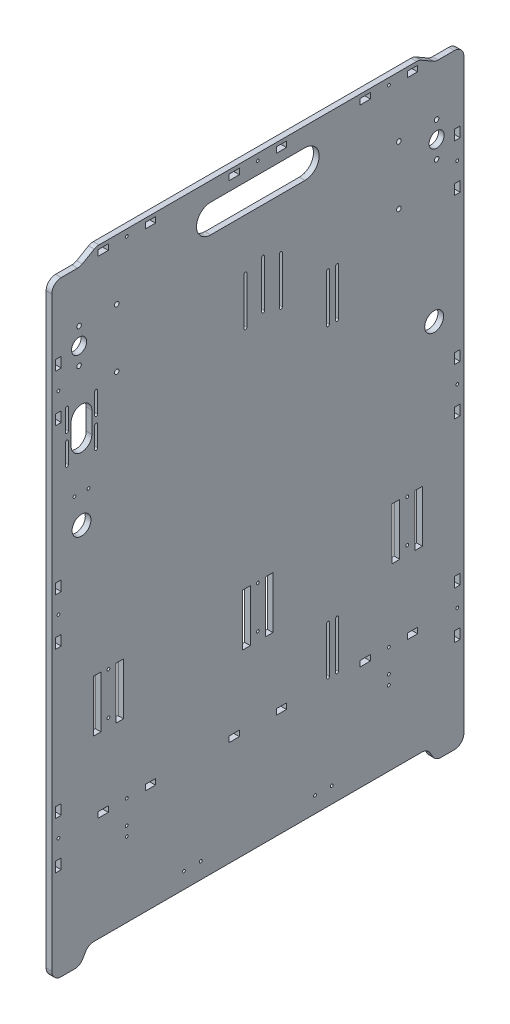
from build123d import *
from build123d.topology import SkipClean

# Parameters (mm, degrees)
SKETCH1_R             = 1.5
SKETCH1_W             = 10.8
SKETCH1_H             = 6
SKETCH1_H_2           = 7
SKETCH1_W_2           = 6
SKETCH1_H_3           = 10.8
BOSS_EXTRUDE1_DEPTH   = 6
SKETCH2_R             = 8
SKETCH2_R_2           = 2.425
CUT_EXTRUDE1_DEPTH    = 688.648458516
FILLET2_R             = 10
FILLET2_OF_MIRROR1_R  = 10
CUT_EXTRUDE2_DEPTH    = 688.648458516
SKETCH4_R             = 2.425
SKETCH4_R_2           = 1.5
SKETCH4_W             = 8
SKETCH4_H             = 55
CUT_EXTRUDE3_DEPTH    = 688.648458516
SKETCH5_R             = 1.5
CUT_EXTRUDE6_DEPTH    = 688.648458516
DELETEFACE2_START     = -169.366666667
DELETEFACE2_OUTLINE_W = 6
DELETEFACE2_OUTLINE_H = 7
DELETEFACE2_DEPTH     = 338.733333334
SKETCH7_R             = 1.5
CUT_EXTRUDE7_DEPTH    = 688.648458516
DELETEFACE3_OUTLINE_R = 1.5
DELETEFACE3_DEPTH     = 6
CUT_EXTRUDE8_DEPTH    = 688.648458516
SKETCH9_R             = 10
CUT_EXTRUDE9_DEPTH    = 688.648458516
SKETCH10_R            = 1.5
CUT_EXTRUDE10_DEPTH   = 688.648458516
CUT_EXTRUDE11_DEPTH   = 688.648458516


# Read off the part's stored shape, not the designer's step: DeleteFace2, DeleteFace3
with BuildPart() as part:
    # Sketch1 → Boss-Extrude1 (new body)
    with BuildSketch(Plane(origin=(0, 0, 0), x_dir=(0, 0, -1), z_dir=(1, 0, 0))):
        with BuildLine():
            Line((0, 652), (-171.129491924, 652))
            Line((-171.129491924, 652), (-188.45, 642))
            Line((-188.45, 642), (-218.45, 642))
            Line((-218.45, 642), (-218.45, 0))
            Line((-218.45, 0), (-188.45, 0))
            Line((-188.45, 0), (-179.789745962, 15))
            Line((-179.789745962, 15), (0, 15))
            Line((0, 15), (0, 127.5))
            ThreePointArc((0, 127.5), (-1.5, 129), (0, 130.5))
            Line((0, 130.5), (0, 643.5))
            ThreePointArc((0, 643.5), (-1.5, 645), (0, 646.5))
            Line((0, 646.5), (0, 652))
        make_face()
        with Locations((-211.45, 539.333333333)):
            Circle(SKETCH1_R, mode=Mode.SUBTRACT)
        with Locations((-211.45, 334)):
            Circle(SKETCH1_R, mode=Mode.SUBTRACT)
        with Locations((-211.45, 128.666666667)):
            Circle(SKETCH1_R, mode=Mode.SUBTRACT)
        with Locations((-138.966666667, 129)):
            Circle(SKETCH1_R, mode=Mode.SUBTRACT)
        with Locations((-138.966666667, 645)):
            Circle(SKETCH1_R, mode=Mode.SUBTRACT)
        with Locations((-113.966666667, 645)):
            Rectangle(SKETCH1_W, SKETCH1_H, mode=Mode.SUBTRACT)
        with Locations((-113.966666667, 129)):
            Rectangle(SKETCH1_W, SKETCH1_H, mode=Mode.SUBTRACT)
        with Locations((-113.966666667, 22.5)):
            Rectangle(SKETCH1_W, SKETCH1_H_2, mode=Mode.SUBTRACT)
        with Locations((-211.45, 564.333333333)):
            Rectangle(SKETCH1_W_2, SKETCH1_H_3, mode=Mode.SUBTRACT)
        with Locations((-211.45, 514.333333333)):
            Rectangle(SKETCH1_W_2, SKETCH1_H_3, mode=Mode.SUBTRACT)
        with Locations((-211.45, 359)):
            Rectangle(SKETCH1_W_2, SKETCH1_H_3, mode=Mode.SUBTRACT)
        with Locations((-211.45, 309)):
            Rectangle(SKETCH1_W_2, SKETCH1_H_3, mode=Mode.SUBTRACT)
        with Locations((-211.45, 153.666666667)):
            Rectangle(SKETCH1_W_2, SKETCH1_H_3, mode=Mode.SUBTRACT)
        with Locations((-211.45, 103.666666667)):
            Rectangle(SKETCH1_W_2, SKETCH1_H_3, mode=Mode.SUBTRACT)
        with Locations((-163.966666667, 129)):
            Rectangle(SKETCH1_W, SKETCH1_H, mode=Mode.SUBTRACT)
        with Locations((-25, 645)):
            Rectangle(SKETCH1_W, SKETCH1_H, mode=Mode.SUBTRACT)
        with Locations((-25, 129)):
            Rectangle(SKETCH1_W, SKETCH1_H, mode=Mode.SUBTRACT)
        with Locations((-163.966666667, 22.5)):
            Rectangle(SKETCH1_W, SKETCH1_H_2, mode=Mode.SUBTRACT)
        with Locations((-25, 22.5)):
            Rectangle(SKETCH1_W, SKETCH1_H_2, mode=Mode.SUBTRACT)
        with Locations((-163.966666667, 645)):
            Rectangle(SKETCH1_W, SKETCH1_H, mode=Mode.SUBTRACT)
    boss_extrude1 = extrude(amount=BOSS_EXTRUDE1_DEPTH)

    # Sketch2 → Cut-Extrude1 (cut, through all)
    with BuildSketch(Plane(origin=(6, 0, 0), x_dir=(0, 0, -1), z_dir=(1, 0, 0))):
        with Locations((-189.55, 569.8)):
            Circle(SKETCH2_R)
        with Locations((-189.55, 588.05)):
            Circle(SKETCH2_R_2)
        with Locations((-189.55, 551.55)):
            Circle(SKETCH2_R_2)
    cut_extrude1 = extrude(amount=-CUT_EXTRUDE1_DEPTH, mode=Mode.SUBTRACT)

    # Fillet2
    fillet2_edges = [part.edges().sort_by_distance(p)[0] for p in [
        (3, 15, 179.789745962),
        (3, 0, 188.45),
        (3, 0, 218.45),
        (3, 642, 218.45),
        (3, 642, 188.45),
        (3, 652, 171.129491924),
    ]]
    fillet(fillet2_edges, radius=FILLET2_R)

    # Mirror1: Boss-Extrude1, Cut-Extrude1 across plane
    with SkipClean():  # the faces are left unmerged after this step: merging them gives an invalid solid
        add(boss_extrude1.mirror(Plane(origin=(6, 130.5, 0), x_dir=(1, 0, 0), z_dir=(0, 0, 1))))
        add(cut_extrude1.mirror(Plane(origin=(6, 130.5, 0), x_dir=(1, 0, 0), z_dir=(0, 0, 1))), mode=Mode.SUBTRACT)

    # Fillet2 of Mirror1
    fillet2_of_mirror1_edges = [part.edges().sort_by_distance(p)[0] for p in [
        (3, 15, -179.789745962),
        (3, 0, -188.45),
        (3, 0, -218.45),
        (3, 642, -218.45),
        (3, 642, -188.45),
        (3, 652, -171.129491924),
    ]]
    fillet(fillet2_of_mirror1_edges, radius=FILLET2_OF_MIRROR1_R)

    # Sketch3 → Cut-Extrude2 (cut, through all)
    with BuildSketch(Plane(origin=(6, 0, 0), x_dir=(0, 0, -1), z_dir=(1, 0, 0))):
        with BuildLine():
            Line((-50, 632), (50, 632))
            ThreePointArc((50, 632), (65, 617), (50, 602))
            Line((50, 602), (-50, 602))
            ThreePointArc((-50, 602), (-65, 617), (-50, 632))
        make_face()
    extrude(amount=-CUT_EXTRUDE2_DEPTH, mode=Mode.SUBTRACT)

    # Sketch4 → Cut-Extrude3 (cut, through all)
    with BuildSketch(Plane(origin=(6, 0, 0), x_dir=(0, 0, -1), z_dir=(1, 0, 0))):
        with Locations((-149.55, 588.05)):
            Circle(SKETCH4_R)
        with Locations((-149.55, 526.05)):
            Circle(SKETCH4_R)
        with Locations((-158.45, 257.333333333)):
            Circle(SKETCH4_R_2)
        with Locations((-158.45, 212.833333333)):
            Circle(SKETCH4_R_2)
        with Locations((0, 257.333333333)):
            Circle(SKETCH4_R_2)
        with Locations((0, 212.833333333)):
            Circle(SKETCH4_R_2)
        with Locations((-170.45, 231.333333333)):
            Rectangle(SKETCH4_W, SKETCH4_H)
        with Locations((-146.45, 231.333333333)):
            Rectangle(SKETCH4_W, SKETCH4_H)
        with Locations((-12, 231.333333333)):
            Rectangle(SKETCH4_W, SKETCH4_H)
        with Locations((12, 231.333333333)):
            Rectangle(SKETCH4_W, SKETCH4_H)
    cut_extrude3 = extrude(amount=-CUT_EXTRUDE3_DEPTH, mode=Mode.SUBTRACT)

    # Mirror2: Cut-Extrude3 across plane
    add(cut_extrude3.mirror(Plane.XY), mode=Mode.SUBTRACT)

    # Sketch5 → Cut-Extrude6 (cut, through all)
    with BuildSketch(Plane(origin=(6, 0, 0), x_dir=(0, 0, -1), z_dir=(1, 0, 0))):
        with Locations((-78.383333333, 31.95)):
            Circle(SKETCH5_R)
        with Locations((-60.583333333, 31.95)):
            Circle(SKETCH5_R)
    cut_extrude6 = extrude(amount=-CUT_EXTRUDE6_DEPTH, mode=Mode.SUBTRACT)

    # Mirror3: Cut-Extrude6 across plane
    add(cut_extrude6.mirror(Plane.XY), mode=Mode.SUBTRACT)

    # DeleteFace2 outline → DeleteFace2 (add)
    with BuildSketch(Plane.XY.offset(DELETEFACE2_START)):
        with Locations((3, 22.5)):
            Rectangle(DELETEFACE2_OUTLINE_W, DELETEFACE2_OUTLINE_H)
    extrude(amount=DELETEFACE2_DEPTH)

    # Sketch7 → Cut-Extrude7 (cut, through all)
    with BuildSketch(Plane(origin=(6, 0, 0), x_dir=(0, 0, -1), z_dir=(1, 0, 0))):
        with Locations((-194.45, 433.843908623)):
            Circle(SKETCH7_R)
        with Locations((-179.45, 433.843908623)):
            Circle(SKETCH7_R)
        with BuildLine():
            Line((-200.95, 519.343908623), (-200.95, 497.343908623))
            ThreePointArc((-200.95, 497.343908623), (-202.45, 495.843908623), (-203.95, 497.343908623))
            Line((-203.95, 497.343908623), (-203.95, 519.343908623))
            ThreePointArc((-203.95, 519.343908623), (-202.45, 520.843908623), (-200.95, 519.343908623))
        make_face()
        with BuildLine():
            Line((-169.95, 519.343908623), (-169.95, 497.343908623))
            ThreePointArc((-169.95, 497.343908623), (-171.45, 495.843908623), (-172.95, 497.343908623))
            Line((-172.95, 497.343908623), (-172.95, 519.343908623))
            ThreePointArc((-172.95, 519.343908623), (-171.45, 520.843908623), (-169.95, 519.343908623))
        make_face()
        with BuildLine():
            Line((-169.95, 488.343908623), (-169.95, 466.343908623))
            ThreePointArc((-169.95, 466.343908623), (-171.45, 464.843908623), (-172.95, 466.343908623))
            Line((-172.95, 466.343908623), (-172.95, 488.343908623))
            ThreePointArc((-172.95, 488.343908623), (-171.45, 489.843908623), (-169.95, 488.343908623))
        make_face()
        with BuildLine():
            Line((-200.95, 488.343908623), (-200.95, 466.343908623))
            ThreePointArc((-200.95, 466.343908623), (-202.45, 464.843908623), (-203.95, 466.343908623))
            Line((-203.95, 466.343908623), (-203.95, 488.343908623))
            ThreePointArc((-203.95, 488.343908623), (-202.45, 489.843908623), (-200.95, 488.343908623))
        make_face()
        with BuildLine():
            Line((-197.95, 481.843908623), (-197.95, 503.843908623))
            ThreePointArc((-197.95, 503.843908623), (-186.95, 514.843908623), (-175.95, 503.843908623))
            Line((-175.95, 503.843908623), (-175.95, 481.843908623))
            ThreePointArc((-175.95, 481.843908623), (-186.95, 470.843908623), (-197.95, 481.843908623))
        make_face()
    extrude(amount=-CUT_EXTRUDE7_DEPTH, mode=Mode.SUBTRACT)

    # DeleteFace3 outline → DeleteFace3 (add)
    with BuildSketch(Plane.YZ):
        with Locations((129, 0)):
            Circle(DELETEFACE3_OUTLINE_R)
    extrude(amount=DELETEFACE3_DEPTH)

    # Sketch8 → Cut-Extrude8 (cut, through all)
    with BuildSketch(Plane(origin=(6, 0, 0), x_dir=(0, 0, -1), z_dir=(1, 0, 0))):
        with BuildLine():
            Line((72.925, 133.5), (72.925, 183.5))
            ThreePointArc((72.925, 183.5), (74.425, 185), (75.925, 183.5))
            Line((75.925, 183.5), (75.925, 133.5))
            ThreePointArc((75.925, 133.5), (74.425, 132), (72.925, 133.5))
        make_face()
        with BuildLine():
            Line((82.525, 133.5), (82.525, 183.5))
            ThreePointArc((82.525, 183.5), (84.025, 185), (85.525, 183.5))
            Line((85.525, 183.5), (85.525, 133.5))
            ThreePointArc((85.525, 133.5), (84.025, 132), (82.525, 133.5))
        make_face()
        with BuildLine():
            Line((72.925, 457), (72.925, 507))
            ThreePointArc((72.925, 507), (74.425, 508.5), (75.925, 507))
            Line((75.925, 507), (75.925, 457))
            ThreePointArc((75.925, 457), (74.425, 455.5), (72.925, 457))
        make_face()
        with BuildLine():
            Line((82.525, 457), (82.525, 507))
            ThreePointArc((82.525, 507), (84.025, 508.5), (85.525, 507))
            Line((85.525, 507), (85.525, 457))
            ThreePointArc((85.525, 457), (84.025, 455.5), (82.525, 457))
        make_face()
    extrude(amount=-CUT_EXTRUDE8_DEPTH, mode=Mode.SUBTRACT)

    # Sketch9 → Cut-Extrude9 (cut, through all)
    with BuildSketch(Plane(origin=(6, 0, 0), x_dir=(0, 0, -1), z_dir=(1, 0, 0))):
        with Locations((-186.95, 403.843908623)):
            Circle(SKETCH9_R)
    cut_extrude9 = extrude(amount=-CUT_EXTRUDE9_DEPTH, mode=Mode.SUBTRACT)

    # Mirror4: Cut-Extrude9 across plane
    add(cut_extrude9.mirror(Plane.XY), mode=Mode.SUBTRACT)

    # Sketch10 → Cut-Extrude10 (cut, through all)
    with BuildSketch(Plane(origin=(6, 0, 0), x_dir=(0, 0, -1), z_dir=(1, 0, 0))):
        with Locations((-138.966666667, 94)):
            Circle(SKETCH10_R)
        with Locations((-138.966666667, 104)):
            Circle(SKETCH10_R)
    cut_extrude10 = extrude(amount=-CUT_EXTRUDE10_DEPTH, mode=Mode.SUBTRACT)

    # Mirror5: Cut-Extrude10 across plane
    add(cut_extrude10.mirror(Plane.XY), mode=Mode.SUBTRACT)

    # Sketch11 → Cut-Extrude11 (cut, through all)
    with BuildSketch(Plane(origin=(6, 0, 0), x_dir=(0, 0, -1), z_dir=(1, 0, 0))):
        with BuildLine():
            Line((4.15, 503.9), (4.15, 553.9))
            ThreePointArc((4.15, 553.9), (5.65, 555.4), (7.15, 553.9))
            Line((7.15, 553.9), (7.15, 503.9))
            ThreePointArc((7.15, 503.9), (5.65, 502.4), (4.15, 503.9))
        make_face()
        with BuildLine():
            Line((25.95, 547.95), (25.95, 497.95))
            ThreePointArc((25.95, 497.95), (24.45, 496.45), (22.95, 497.95))
            Line((22.95, 497.95), (22.95, 547.95))
            ThreePointArc((22.95, 547.95), (24.45, 549.45), (25.95, 547.95))
        make_face()
        with BuildLine():
            Line((-11.65, 547.95), (-11.65, 497.95))
            ThreePointArc((-11.65, 497.95), (-13.15, 496.45), (-14.65, 497.95))
            Line((-14.65, 497.95), (-14.65, 547.95))
            ThreePointArc((-14.65, 547.95), (-13.15, 549.45), (-11.65, 547.95))
        make_face()
    extrude(amount=-CUT_EXTRUDE11_DEPTH, mode=Mode.SUBTRACT)


solid = part.part
